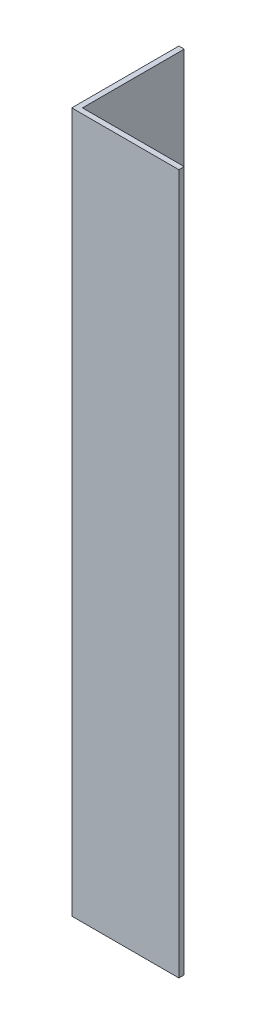
from build123d import *

# Parameters (mm, degrees)
EXTRUDE_1_DEPTH = 98


with BuildPart() as part:
    # Эскиз1 → Бобышка-Вытянуть1 (new body)
    with BuildSketch(Plane(origin=(0, 0, 0), x_dir=(1, 0, 0), z_dir=(0, 1, 0))):
        Polygon((0, 0), (0, 15), (0.75, 15), (0.75, 0.75), (15, 0.75), (15, 0), align=None)
    extrude(amount=EXTRUDE_1_DEPTH)


solid = part.part
